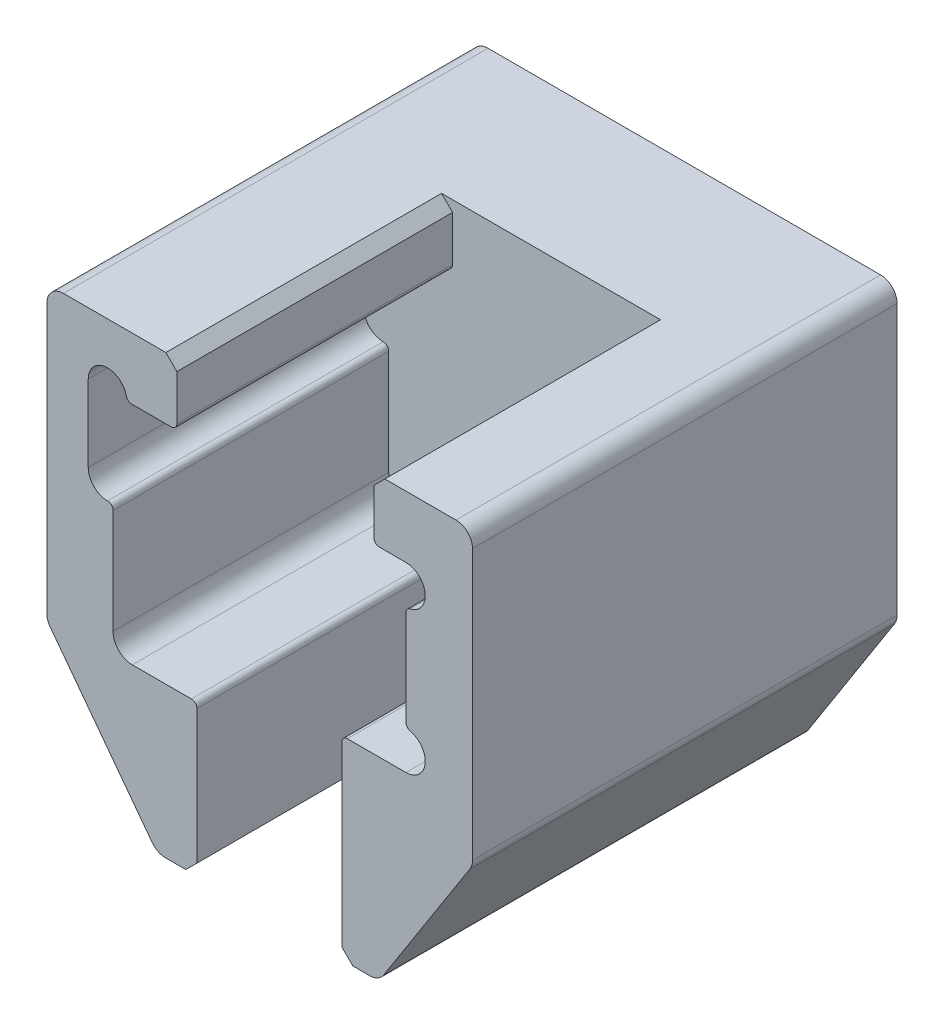
from build123d import *

# Parameters (mm, degrees)
SALIENTE_EXTRUIR1_DEPTH                      = 38.5
CORTAR_EXTRUIR1_DEPTH                        = 25
REDONDEO2_R                                  = 0.5
REDONDEO3_R                                  = 1.5
PERFORADOR_PARA_ROSCAR_HELICOIL_DE_M81_D     = 8.25
PERFORADOR_PARA_ROSCAR_HELICOIL_DE_M81_DEPTH = 9.5
PERFORADOR_PARA_ROSCAR_HELICOIL_DE_M81_TIP   = 2.478550053
CHAFL_N1_SIZE                                = 1


with BuildPart() as part:
    # Croquis1 → Saliente-Extruir1 (new body)
    with BuildSketch(Plane.XY):
        Polygon((0, 13.3), (0, 39.7), (38.6, 39.7), (38.6, 13.3), (30.1, 0), (10, 0), align=None)
    extrude(amount=SALIENTE_EXTRUIR1_DEPTH)

    # Croquis2 → Cortar-Extruir1 (cut)
    with BuildSketch(Plane.XY.offset(38.5)):
        with BuildLine():
            Line((29.65, 39.7), (29.65, 34.1))
            Line((29.65, 34.1), (32.56, 34.1))
            ThreePointArc((32.56, 34.1), (34.31, 32.35), (32.56, 30.6))
            Line((32.56, 30.6), (32.56, 21.1))
            ThreePointArc((32.56, 21.1), (34.31, 19.35), (32.56, 17.6))
            Line((32.56, 17.6), (26.74, 17.6))
            Line((26.74, 17.6), (26.74, 0))
            Line((26.74, 0), (13.6, 0))
            Line((13.6, 0), (13.6, 13.65))
            Line((13.6, 13.65), (7.75, 13.65))
            ThreePointArc((7.75, 13.65), (6.512563133, 14.162563133), (6, 15.4))
            Line((6, 15.4), (6, 25.4))
            Line((6, 25.4), (5.5, 25.4))
            ThreePointArc((5.5, 25.4), (4.262563133, 25.912563133), (3.75, 27.15))
            Line((3.75, 27.15), (3.75, 34.1))
            ThreePointArc((3.75, 34.1), (5.5, 35.85), (7.25, 34.1))
            Line((7.25, 34.1), (11.79, 34.1))
            Line((11.79, 34.1), (11.79, 39.7))
            Line((11.79, 39.7), (29.65, 39.7))
        make_face()
    extrude(amount=-CORTAR_EXTRUIR1_DEPTH, mode=Mode.SUBTRACT)

    # Redondeo2
    redondeo2_edges = [part.edges().sort_by_distance(p)[0] for p in [
        (13.6, 13.65, 26),
        (11.79, 34.1, 26),
        (29.65, 34.1, 26),
        (32.56, 30.6, 26),
        (32.56, 21.1, 26),
        (26.74, 17.6, 26),
        (7.25, 34.1, 26),
        (6, 25.4, 26),
    ]]
    fillet(redondeo2_edges, radius=REDONDEO2_R - 0.0001)  # a hair under: the kernel refuses the full size

    # Redondeo3
    redondeo3_edges = [part.edges().sort_by_distance(p)[0] for p in [
        (0, 13.3, 19.25),
        (0, 39.7, 19.25),
        (38.6, 39.7, 19.25),
        (38.6, 13.3, 19.25),
        (30.1, 0, 19.25),
        (10, 0, 19.25),
    ]]
    fillet(redondeo3_edges, radius=REDONDEO3_R)

    # Perforador para roscar Helicoil de M81
    with Locations(Plane(origin=(0, 0, 0), x_dir=(-1, 0, 0), z_dir=(0, 0, -1))):
        with Locations((-20.6, 10)):
            Hole(PERFORADOR_PARA_ROSCAR_HELICOIL_DE_M81_D / 2, depth=PERFORADOR_PARA_ROSCAR_HELICOIL_DE_M81_DEPTH)
            with Locations((0, 0, -(PERFORADOR_PARA_ROSCAR_HELICOIL_DE_M81_DEPTH + PERFORADOR_PARA_ROSCAR_HELICOIL_DE_M81_TIP / 2))):  # 118° drill point
                Cone(0, PERFORADOR_PARA_ROSCAR_HELICOIL_DE_M81_D / 2, PERFORADOR_PARA_ROSCAR_HELICOIL_DE_M81_TIP, mode=Mode.SUBTRACT)

    # Chaflán1
    chafl_n1_edges = [part.edges().sort_by_distance(p)[0] for p in [
        (11.79, 39.7, 26),
        (29.65, 39.7, 26),
        (26.74, 0, 26),
        (13.6, 0, 26),
    ]]
    chamfer(chafl_n1_edges, length=CHAFL_N1_SIZE)


solid = part.part
